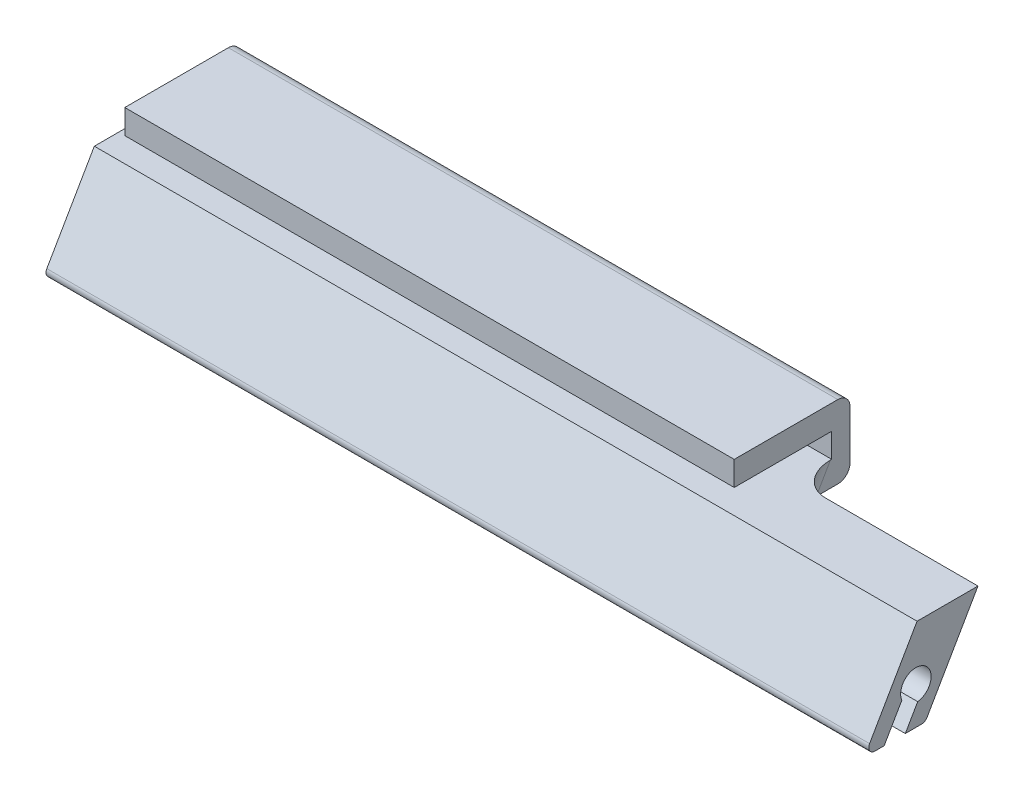
from build123d import *

# Parameters (mm, degrees)
SKETCH2_W                = 3.0000000000000036
SKETCH2_H                = 3.9999999999999982
BOSS_EXTRUDE2_DEPTH      = 100
BOSS_EXTRUDE3_DEPTH      = 30
BOSS_EXTRUDE3_DEPTH_BACK = 105
FILLET5_R                = 10
FILLET6_R                = 5
FILLET7_R                = 2
FILLET8_R                = 1


with BuildPart() as part:
    # Sketch2 → Boss-Extrude2 (new body)
    with BuildSketch(Plane(origin=(0, 0, 0), x_dir=(0, 0, -1), z_dir=(1, 0, 0))):
        Polygon((8.660254037844407, 18.999999999999996), (24.660254037844407, 19), (27.660254037844407, 19), (27.660254037844407, 23), (8.660254037844407, 22.999999999999996), align=None)
        with Locations((26.160254037844403, 17)):
            Rectangle(SKETCH2_W, SKETCH2_H)
        Polygon((24.660254037844407, 15), (18.66025403784441, 15), (16.3508529610859, 10.999999999999996), (27.66025403784441, 11), (27.660254037844407, 15), align=None)
        Polygon((18.66025403784441, 15), (8.660254037844407, 15), (8.660254037844409, 11), (16.3508529610859, 11), align=None)
        with BuildLine():
            Line((8.660254037844407, 15.000000000000002), (0, 0))
            Line((0, 0), (3.2679491924311206, 1.4e-16))
            Line((3.2679491924311206, -8.2e-16), (6.165063509461155, 5.017949192431213))
            ThreePointArc((6.165063509461059, 5.017949192431232), (7.962900689456138, 8.449244298165432), (10.964101615137764, 6))
            ThreePointArc((10.964101615137764, 5.999999999999999), (10.334608934582356, 4.341325116876664), (8.763139720814397, 3.5179491924311193))
            Line((8.763139720814408, 3.5179491924311046), (6.732050807568877, 0))
            Line((6.732050807568877, 2.8e-16), (10.000000000000004, 4.1e-16))
            Line((10.000000000000004, -1.78e-15), (16.3508529610859, 10.999999999999996))
            Line((16.3508529610859, 11), (8.660254037844409, 11))
            Line((8.660254037844409, 11), (8.660254037844407, 15))
        make_face()
    extrude(amount=BOSS_EXTRUDE2_DEPTH)

    # Sketch3 → Boss-Extrude3 (add, two sides: drawn at the far end of the back side and taken through both)
    with BuildSketch(Plane(origin=(100, 0, 0), x_dir=(0, 0, -1), z_dir=(1, 0, 0)).offset(-BOSS_EXTRUDE3_DEPTH_BACK)):
        with BuildLine():
            Line((8.66025403784439, 15.000000000000005), (0, 0))
            Line((0, 0), (3.2679491924311215, 2.8e-16))
            Line((3.267949192431121, 0), (6.1650635094611035, 5.017949192431125))
            ThreePointArc((6.165063509461104, 5.017949192431125), (7.962900689456081, 8.449244298165421), (10.964101615137764, 6))
            ThreePointArc((10.964101615137764, 5.999999999999999), (10.334608934582363, 4.341325116876672), (8.763139720814419, 3.517949192431122))
            Line((8.763139720814419, 3.517949192431122), (6.732050807568878, 3.6e-16))
            Line((6.732050807568878, 3.6e-16), (10.000000000000002, 8.7e-16))
            Line((10.000000000000004, 0), (18.66025403784441, 15.000000000000009))
            Line((18.66025403784441, 15.000000000000009), (8.66025403784439, 15.000000000000005))
        make_face()
    extrude(amount=BOSS_EXTRUDE3_DEPTH + BOSS_EXTRUDE3_DEPTH_BACK)

    # Fillet5
    fillet5_edges = [part.edges().sort_by_distance(p)[0] for p in [
        (50, 10.999999999999998, -16.3508529610859),
    ]]
    fillet(fillet5_edges, radius=FILLET5_R)

    # Fillet6
    fillet6_edges = [part.edges().sort_by_distance(p)[0] for p in [
        (0, 10.500000000000007, -16.062177826491087),
        (100, 10.500000000000007, -16.062177826491087),
    ]]
    fillet(fillet6_edges, radius=FILLET6_R - 0.0001)  # a hair under: the kernel refuses the full size

    # Fillet7
    fillet7_edges = [part.edges().sort_by_distance(p)[0] for p in [
        (50, 23, -27.660254037844407),
        (50, 11, -27.66025403784441),
    ]]
    fillet(fillet7_edges, radius=FILLET7_R)

    # Fillet8
    fillet8_edges = [part.edges().sort_by_distance(p)[0] for p in [
        (62.5, 4.3e-16, -10.000000000000004),
        (62.5, 0, 0),
    ]]
    fillet(fillet8_edges, radius=FILLET8_R)


solid = part.part
